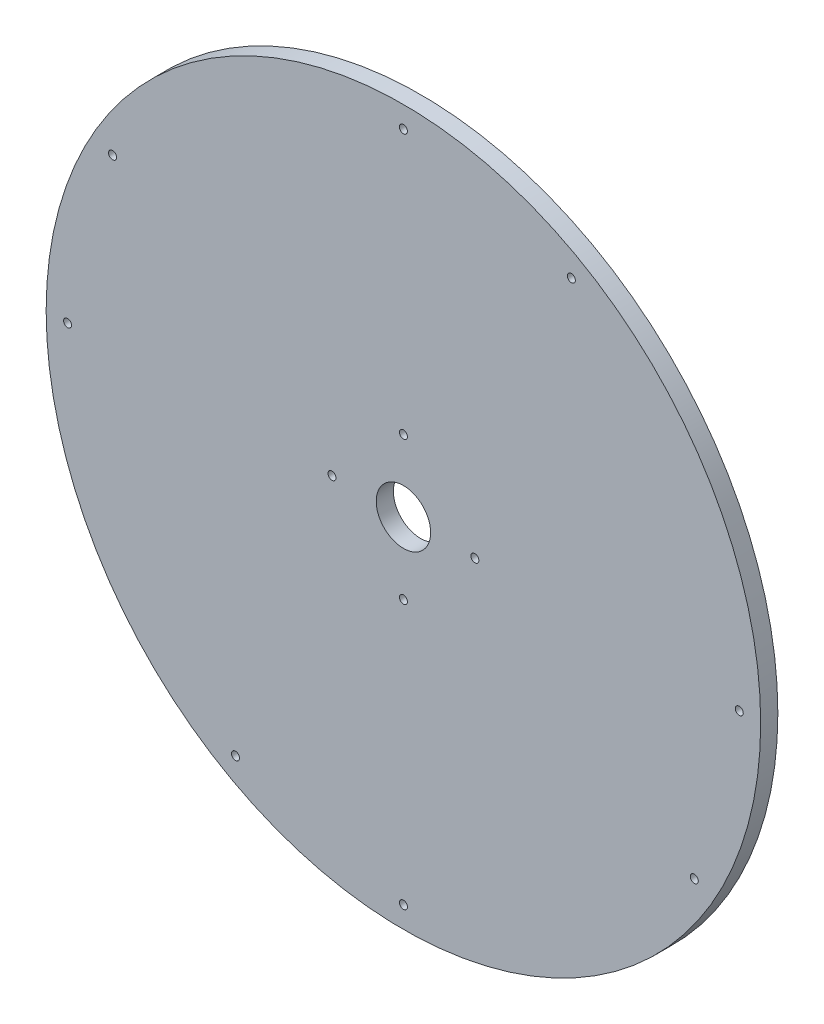
from build123d import *

# Parameters (mm, degrees)
SKETCH1_W          = 6
SKETCH1_H          = 115.475
CUT_EXTRUDE1_REACH = 178.878
SKETCH2_R          = 1.4


with BuildPart() as part:
    # Sketch1 → Revolve1 (revolve)
    with BuildSketch(Plane(origin=(0, 0, 0), x_dir=(0, 0, -1), z_dir=(1, 0, 0))):
        with Locations((3, 67.2625)):
            Rectangle(SKETCH1_W, SKETCH1_H)
    revolve(axis=Axis((0, 0, 0), (0, 0, -1)))

    # Sketch2 → Cut-Extrude1 (cut, up to next)
    with BuildSketch(Plane.XY, mode=Mode.PRIVATE) as cut_extrude1_sk1:
        with Locations((0, 25)):
            Circle(SKETCH2_R)
    cut_extrude1_tool1 = extrude(cut_extrude1_sk1.sketch, amount=-CUT_EXTRUDE1_REACH, mode=Mode.PRIVATE) & part.part
    # Sketch2 → Cut-Extrude1 (cut, up to next)
    with BuildSketch(Plane.XY, mode=Mode.PRIVATE) as cut_extrude1_sk2:
        with Locations((25, 0)):
            Circle(SKETCH2_R)
    cut_extrude1_tool2 = extrude(cut_extrude1_sk2.sketch, amount=-CUT_EXTRUDE1_REACH, mode=Mode.PRIVATE) & part.part
    # Sketch2 → Cut-Extrude1 (cut, up to next)
    with BuildSketch(Plane.XY, mode=Mode.PRIVATE) as cut_extrude1_sk3:
        with Locations((0, -25)):
            Circle(SKETCH2_R)
    cut_extrude1_tool3 = extrude(cut_extrude1_sk3.sketch, amount=-CUT_EXTRUDE1_REACH, mode=Mode.PRIVATE) & part.part
    # Sketch2 → Cut-Extrude1 (cut, up to next)
    with BuildSketch(Plane.XY, mode=Mode.PRIVATE) as cut_extrude1_sk4:
        with Locations((-25, 0)):
            Circle(SKETCH2_R)
    cut_extrude1_tool4 = extrude(cut_extrude1_sk4.sketch, amount=-CUT_EXTRUDE1_REACH, mode=Mode.PRIVATE) & part.part
    # Sketch2 → Cut-Extrude1 (cut, up to next)
    with BuildSketch(Plane.XY, mode=Mode.PRIVATE) as cut_extrude1_sk5:
        with Locations((0, 117.5)):
            Circle(SKETCH2_R)
    cut_extrude1_tool5 = extrude(cut_extrude1_sk5.sketch, amount=-CUT_EXTRUDE1_REACH, mode=Mode.PRIVATE) & part.part
    # Sketch2 → Cut-Extrude1 (cut, up to next)
    with BuildSketch(Plane.XY, mode=Mode.PRIVATE) as cut_extrude1_sk6:
        with Locations((0, -117.5)):
            Circle(SKETCH2_R)
    cut_extrude1_tool6 = extrude(cut_extrude1_sk6.sketch, amount=-CUT_EXTRUDE1_REACH, mode=Mode.PRIVATE) & part.part
    # Sketch2 → Cut-Extrude1 (cut, up to next)
    with BuildSketch(Plane.XY, mode=Mode.PRIVATE) as cut_extrude1_sk7:
        with Locations((-117.5, 0)):
            Circle(SKETCH2_R)
    cut_extrude1_tool7 = extrude(cut_extrude1_sk7.sketch, amount=-CUT_EXTRUDE1_REACH, mode=Mode.PRIVATE) & part.part
    # Sketch2 → Cut-Extrude1 (cut, up to next)
    with BuildSketch(Plane.XY, mode=Mode.PRIVATE) as cut_extrude1_sk8:
        with Locations((117.5, 0)):
            Circle(SKETCH2_R)
    cut_extrude1_tool8 = extrude(cut_extrude1_sk8.sketch, amount=-CUT_EXTRUDE1_REACH, mode=Mode.PRIVATE) & part.part
    # Sketch2 → Cut-Extrude1 (cut, up to next)
    with BuildSketch(Plane.XY, mode=Mode.PRIVATE) as cut_extrude1_sk9:
        with Locations((58.75, 101.757984945)):
            Circle(SKETCH2_R)
    cut_extrude1_tool9 = extrude(cut_extrude1_sk9.sketch, amount=-CUT_EXTRUDE1_REACH, mode=Mode.PRIVATE) & part.part
    # Sketch2 → Cut-Extrude1 (cut, up to next)
    with BuildSketch(Plane.XY, mode=Mode.PRIVATE) as cut_extrude1_sk10:
        with Locations((101.757984945, -58.75)):
            Circle(SKETCH2_R)
    cut_extrude1_tool10 = extrude(cut_extrude1_sk10.sketch, amount=-CUT_EXTRUDE1_REACH, mode=Mode.PRIVATE) & part.part
    # Sketch2 → Cut-Extrude1 (cut, up to next)
    with BuildSketch(Plane.XY, mode=Mode.PRIVATE) as cut_extrude1_sk11:
        with Locations((-58.75, -101.757984945)):
            Circle(SKETCH2_R)
    cut_extrude1_tool11 = extrude(cut_extrude1_sk11.sketch, amount=-CUT_EXTRUDE1_REACH, mode=Mode.PRIVATE) & part.part
    # Sketch2 → Cut-Extrude1 (cut, up to next)
    with BuildSketch(Plane.XY, mode=Mode.PRIVATE) as cut_extrude1_sk12:
        with Locations((-101.757984945, 58.75)):
            Circle(SKETCH2_R)
    cut_extrude1_tool12 = extrude(cut_extrude1_sk12.sketch, amount=-CUT_EXTRUDE1_REACH, mode=Mode.PRIVATE) & part.part
    add(cut_extrude1_tool1.solids().sort_by_distance((0, 25, 0))[0], mode=Mode.SUBTRACT)
    add(cut_extrude1_tool2.solids().sort_by_distance((25, 0, 0))[0], mode=Mode.SUBTRACT)
    add(cut_extrude1_tool3.solids().sort_by_distance((0, -25, 0))[0], mode=Mode.SUBTRACT)
    add(cut_extrude1_tool4.solids().sort_by_distance((-25, 0, 0))[0], mode=Mode.SUBTRACT)
    add(cut_extrude1_tool5.solids().sort_by_distance((0, 117.5, 0))[0], mode=Mode.SUBTRACT)
    add(cut_extrude1_tool6.solids().sort_by_distance((0, -117.5, 0))[0], mode=Mode.SUBTRACT)
    add(cut_extrude1_tool7.solids().sort_by_distance((-117.5, 0, 0))[0], mode=Mode.SUBTRACT)
    add(cut_extrude1_tool8.solids().sort_by_distance((117.5, 0, 0))[0], mode=Mode.SUBTRACT)
    add(cut_extrude1_tool9.solids().sort_by_distance((58.75, 101.757985, 0))[0], mode=Mode.SUBTRACT)
    add(cut_extrude1_tool10.solids().sort_by_distance((101.757985, -58.75, 0))[0], mode=Mode.SUBTRACT)
    add(cut_extrude1_tool11.solids().sort_by_distance((-58.75, -101.757985, 0))[0], mode=Mode.SUBTRACT)
    add(cut_extrude1_tool12.solids().sort_by_distance((-101.757985, 58.75, 0))[0], mode=Mode.SUBTRACT)


solid = part.part
